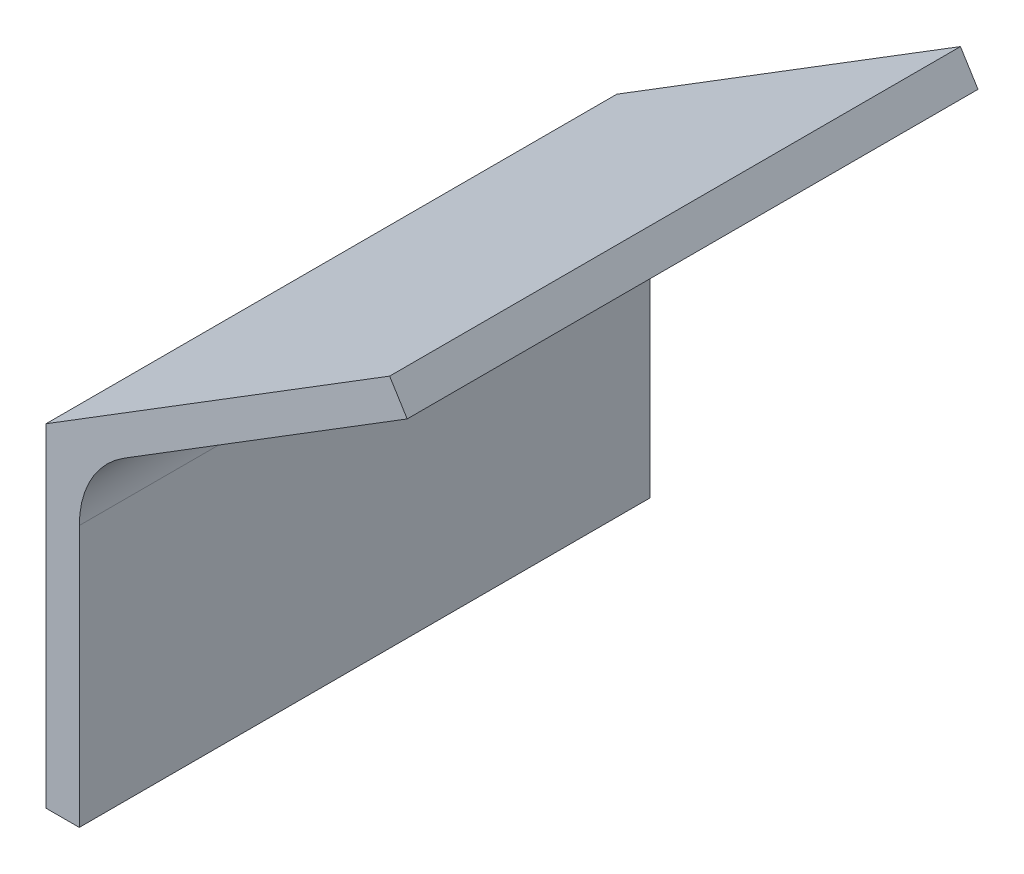
from build123d import *

# Parameters (mm, degrees)
BOSS_EXTRUDE1_DEPTH = 60
FILLET1_R           = 20


with BuildPart() as part:
    # Sketch1 → Boss-Extrude1 (new, symmetric)
    with BuildSketch(Plane.XY):
        Polygon((0, 0), (72.240878904, 44.791242617), (75.929569472, 38.841993766), (7, -3.896150019), (7, -70), (0, -70), align=None)
    extrude(amount=BOSS_EXTRUDE1_DEPTH, both=True)

    # Fillet1
    fillet1_edges = [part.edges().sort_by_distance(p)[0] for p in [
        (7, -3.896150019, 0),
    ]]
    fillet(fillet1_edges, radius=FILLET1_R)


solid = part.part
